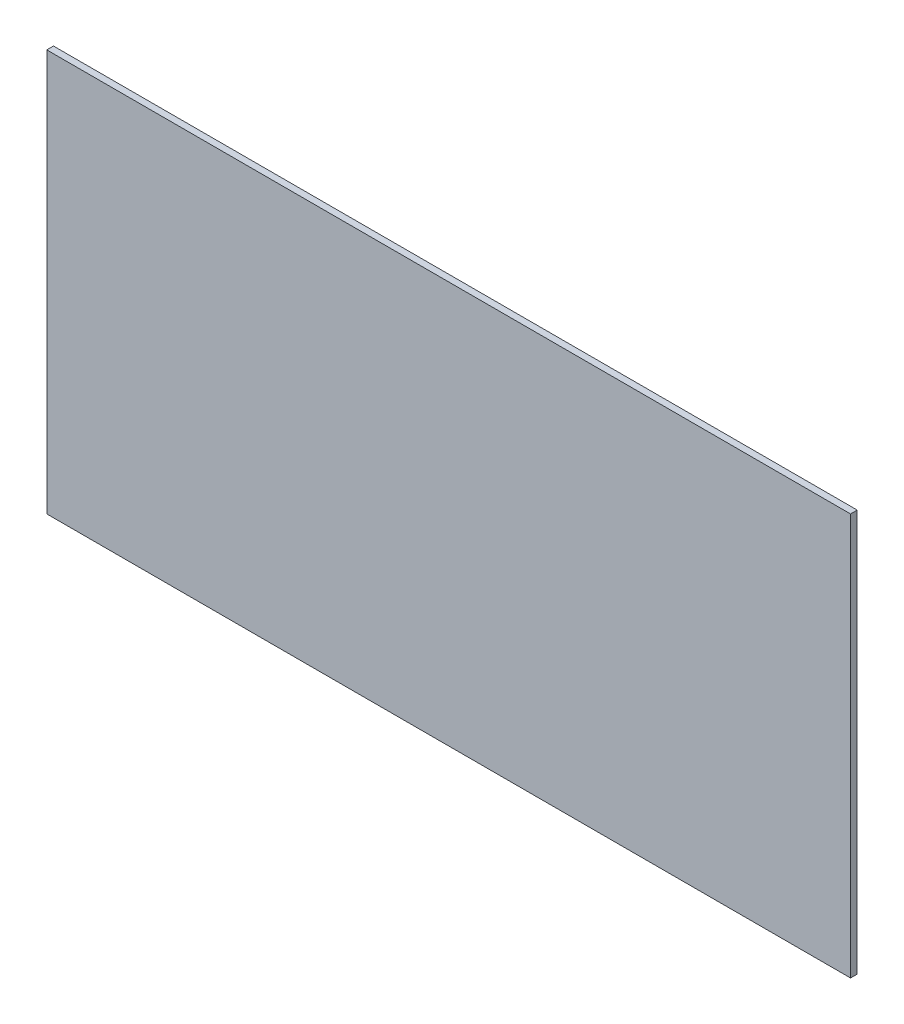
from build123d import *

# Parameters (mm, degrees)
SKETCH1_W          = 120
SKETCH1_H          = 60
BASE_FLANGE1_DEPTH = 1


# Sheet-metal steps are written as plain solids
with BuildPart() as part:
    # Sketch1 → Base-Flange1 (new body)
    with BuildSketch(Plane.XY):
        with Locations((60, 30)):
            Rectangle(SKETCH1_W, SKETCH1_H)
    extrude(amount=-BASE_FLANGE1_DEPTH)


solid = part.part
